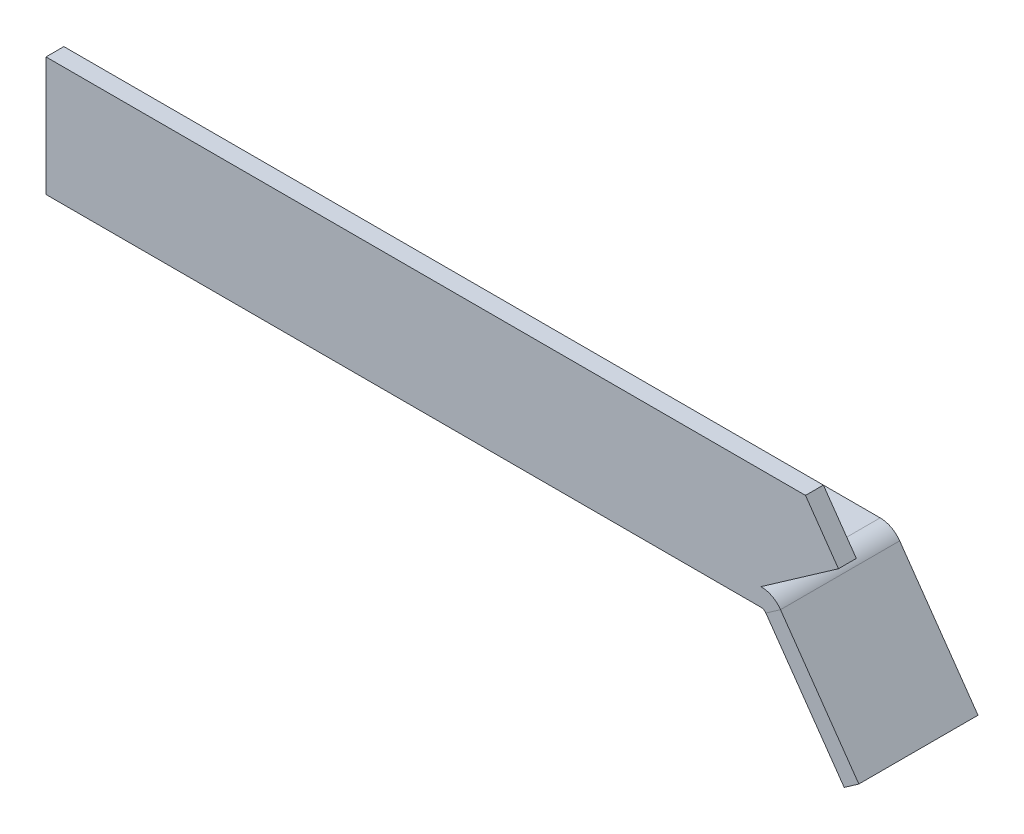
from build123d import *

# Parameters (mm, degrees)
EXTRUDE_1_DEPTH        = 120
SKETCH_3_W             = 120
SKETCH_3_H             = 20
SM_BASE_FLANGE_1_DEPTH = 3
SM_EDGE_FLANGE_2_DEPTH = 20
EXTRUDE_1_2_DEPTH      = 3


# Sheet-metal steps are written as plain solids
with BuildPart() as part:
    # Sketch 1 → Extrude 1 (new body)
    with BuildSketch(Plane(origin=(0, 0, 0), x_dir=(0, 0, -1), z_dir=(1, 0, 0))):
        Polygon((0, 20), (0, 0), (20, 0), (20, 3), (3, 3), (3, 20), align=None)
    extrude(amount=EXTRUDE_1_DEPTH)



with BuildPart() as body_2:
    # Эскиз3 → Базовая кромка1 (new body)
    with BuildSketch(Plane.XZ):
        with Locations((60, -10)):
            Rectangle(SKETCH_3_W, SKETCH_3_H)
    extrude(amount=-SM_BASE_FLANGE_1_DEPTH)

    # Ребро-кромка2 section (across the edge) → Ребро-кромка2 (add)
    with BuildSketch(Plane(origin=(120.520567051, 0, -20), x_dir=(-0.8191520442889889, -0.5735764363510502, 0), z_dir=(0, 0, 1))):
        with BuildLine():
            Line((-3, 0.520567051), (-3, 23.438298848))
            Line((-3, 23.438298848), (0, 23.438298848))
            Line((0, 23.438298848), (0, 0.520567051))
            ThreePointArc((0, 0.520567051), (0.112989167, 0.058818437), (0.426423564, -0.298584994))
            Line((0.426423564, -0.298584994), (-1.294305745, -2.756041127))
            ThreePointArc((-1.294305745, -2.756041127), (-2.548043333, -1.326427402), (-3, 0.520567051))
        make_face()
    extrude(amount=SM_EDGE_FLANGE_2_DEPTH)


with BuildPart() as part_1:
    add(part.part)

    add(body_2.part)  # Extrude 1 2 merges body 2
    # Эскиз10 → Extrude 1 2 (add)
    with BuildSketch(Plane.XY):
        Polygon((120, 20), (120, 3), (133, 12.102697997), (127.470249606, 20), align=None)
    extrude(amount=-EXTRUDE_1_2_DEPTH)


solid = part_1.part
